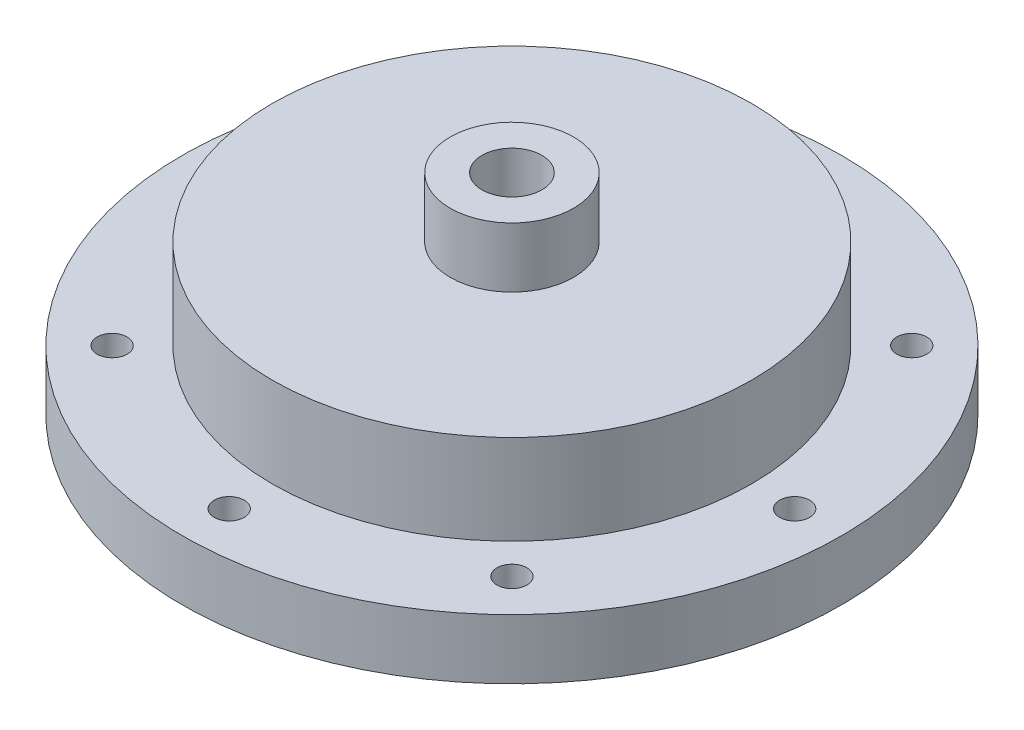
from build123d import *

# Parameters (mm, degrees)
SKETCH1_R           = 50.8
BOSS_EXTRUDE1_DEPTH = 31.75
SKETCH2_R           = 69.85
SKETCH2_R_2         = 50.8
BOSS_EXTRUDE2_DEPTH = 12.7
SKETCH3_R           = 49.53
SKETCH3_R_2         = 47.625
CUT_EXTRUDE1_DEPTH  = 1.1176
CUT_EXTRUDE2_REACH  = 105.76
SKETCH4_R           = 3.175
SKETCH5_R           = 6.35
CUT_EXTRUDE3_DEPTH  = 19.05
CUT_EXTRUDE4_REACH  = 102.603
SKETCH6_R           = 1.5875
CIRPATTERN2_COUNT   = 6
BOSS_EXTRUDE3_START = 12.7
SKETCH34_R          = 13.081
SKETCH34_R_2        = 6.35
BOSS_EXTRUDE3_DEPTH = 12.7


with BuildPart() as part:
    # Sketch1 → Boss-Extrude1 (new body)
    with BuildSketch(Plane(origin=(0, 0, 0), x_dir=(1, 0, 0), z_dir=(0, 1, 0))):
        with Locations(Location((0, 0, 0), (0, 0, 270))):
            Circle(SKETCH1_R)
    extrude(amount=BOSS_EXTRUDE1_DEPTH)

    # Sketch2 → Boss-Extrude2 (add)
    with BuildSketch(Plane.XZ):
        with Locations(Location((0, 0, 0), (0, 0, 270))):
            Circle(SKETCH2_R)
        with Locations(Location((0, 0, 0), (0, 0, 270))):
            Circle(SKETCH2_R_2, mode=Mode.SUBTRACT)
    extrude(amount=-BOSS_EXTRUDE2_DEPTH)

    # Sketch3 → Cut-Extrude1 (cut)
    with BuildSketch(Plane.XZ):
        with Locations(Location((0, 0, 0), (0, 0, 270))):
            Circle(SKETCH3_R)
        with Locations(Location((0, 0, 0), (0, 0, 270))):
            Circle(SKETCH3_R_2, mode=Mode.SUBTRACT)
    extrude(amount=-CUT_EXTRUDE1_DEPTH, mode=Mode.SUBTRACT)

    # Sketch4 → Cut-Extrude2 (cut, up to next)
    with BuildSketch(Plane.XZ, mode=Mode.PRIVATE) as cut_extrude2_sk1:
        with Locations(Location((0, -59.9186, 0), (0, 0, 270))):
            Circle(SKETCH4_R)
    cut_extrude2_tool1 = extrude(cut_extrude2_sk1.sketch, amount=-CUT_EXTRUDE2_REACH, mode=Mode.PRIVATE) & part.part
    # Sketch4 → Cut-Extrude2 (cut, up to next)
    with BuildSketch(Plane.XZ, mode=Mode.PRIVATE) as cut_extrude2_sk2:
        with Locations(Location((-42.368848379, -42.368848379, 0), (0, 0, 270))):
            Circle(SKETCH4_R)
    cut_extrude2_tool2 = extrude(cut_extrude2_sk2.sketch, amount=-CUT_EXTRUDE2_REACH, mode=Mode.PRIVATE) & part.part
    # Sketch4 → Cut-Extrude2 (cut, up to next)
    with BuildSketch(Plane.XZ, mode=Mode.PRIVATE) as cut_extrude2_sk3:
        with Locations(Location((-59.9186, 0, 0), (0, 0, 270))):
            Circle(SKETCH4_R)
    cut_extrude2_tool3 = extrude(cut_extrude2_sk3.sketch, amount=-CUT_EXTRUDE2_REACH, mode=Mode.PRIVATE) & part.part
    # Sketch4 → Cut-Extrude2 (cut, up to next)
    with BuildSketch(Plane.XZ, mode=Mode.PRIVATE) as cut_extrude2_sk4:
        with Locations(Location((-42.368848379, 42.368848379, 0), (0, 0, 270))):
            Circle(SKETCH4_R)
    cut_extrude2_tool4 = extrude(cut_extrude2_sk4.sketch, amount=-CUT_EXTRUDE2_REACH, mode=Mode.PRIVATE) & part.part
    # Sketch4 → Cut-Extrude2 (cut, up to next)
    with BuildSketch(Plane.XZ, mode=Mode.PRIVATE) as cut_extrude2_sk5:
        with Locations(Location((0, 59.9186, 0), (0, 0, 270))):
            Circle(SKETCH4_R)
    cut_extrude2_tool5 = extrude(cut_extrude2_sk5.sketch, amount=-CUT_EXTRUDE2_REACH, mode=Mode.PRIVATE) & part.part
    # Sketch4 → Cut-Extrude2 (cut, up to next)
    with BuildSketch(Plane.XZ, mode=Mode.PRIVATE) as cut_extrude2_sk6:
        with Locations(Location((42.368848379, 42.368848379, 0), (0, 0, 270))):
            Circle(SKETCH4_R)
    cut_extrude2_tool6 = extrude(cut_extrude2_sk6.sketch, amount=-CUT_EXTRUDE2_REACH, mode=Mode.PRIVATE) & part.part
    # Sketch4 → Cut-Extrude2 (cut, up to next)
    with BuildSketch(Plane.XZ, mode=Mode.PRIVATE) as cut_extrude2_sk7:
        with Locations(Location((59.9186, 0, 0), (0, 0, 270))):
            Circle(SKETCH4_R)
    cut_extrude2_tool7 = extrude(cut_extrude2_sk7.sketch, amount=-CUT_EXTRUDE2_REACH, mode=Mode.PRIVATE) & part.part
    # Sketch4 → Cut-Extrude2 (cut, up to next)
    with BuildSketch(Plane.XZ, mode=Mode.PRIVATE) as cut_extrude2_sk8:
        with Locations(Location((42.368848379, -42.368848379, 0), (0, 0, 270))):
            Circle(SKETCH4_R)
    cut_extrude2_tool8 = extrude(cut_extrude2_sk8.sketch, amount=-CUT_EXTRUDE2_REACH, mode=Mode.PRIVATE) & part.part
    add(cut_extrude2_tool1.solids().sort_by_distance((0, 0, -59.9186))[0], mode=Mode.SUBTRACT)
    add(cut_extrude2_tool2.solids().sort_by_distance((-42.368848, 0, -42.368848))[0], mode=Mode.SUBTRACT)
    add(cut_extrude2_tool3.solids().sort_by_distance((-59.9186, 0, 0))[0], mode=Mode.SUBTRACT)
    add(cut_extrude2_tool4.solids().sort_by_distance((-42.368848, 0, 42.368848))[0], mode=Mode.SUBTRACT)
    add(cut_extrude2_tool5.solids().sort_by_distance((0, 0, 59.9186))[0], mode=Mode.SUBTRACT)
    add(cut_extrude2_tool6.solids().sort_by_distance((42.368848, 0, 42.368848))[0], mode=Mode.SUBTRACT)
    add(cut_extrude2_tool7.solids().sort_by_distance((59.9186, 0, 0))[0], mode=Mode.SUBTRACT)
    add(cut_extrude2_tool8.solids().sort_by_distance((42.368848, 0, -42.368848))[0], mode=Mode.SUBTRACT)

    # Sketch5 → Cut-Extrude3 (cut)
    with BuildSketch(Plane(origin=(0, 31.75, 0), x_dir=(1, 0, 0), z_dir=(0, 1, 0))):
        with Locations(Location((0, 0, 0), (0, 0, 270))):
            Circle(SKETCH5_R)
    extrude(amount=-CUT_EXTRUDE3_DEPTH, mode=Mode.SUBTRACT)

    # Sketch6 → Cut-Extrude4 (cut, up to next)
    with BuildSketch(Plane(origin=(0, 12.7, 0), x_dir=(1, 0, 0), z_dir=(0, 1, 0)), mode=Mode.PRIVATE) as cut_extrude4_sk1:
        with Locations(Location((0, 0, 0), (0, 0, 270))):
            Circle(SKETCH6_R)
    cut_extrude4_tool1 = extrude(cut_extrude4_sk1.sketch, amount=-CUT_EXTRUDE4_REACH, mode=Mode.PRIVATE) & part.part
    add(cut_extrude4_tool1.solids().sort_by_distance((0, 12.7, 0))[0], mode=Mode.SUBTRACT)

    # Cut-Sweep8: read off the stored shape, not the designer's step
    # Cut-Sweep8: loft between two sections, ruled curve by curve
    cut_sweep8_from = [
        Edge.make_bspline([(0, 13.990935229, -6.31114181), (2.38125, 13.990935229, -6.31114181), (2.38125, 13.700001029, -3.947731381), (0, 13.700001029, -3.947731381), (-2.38125, 13.700001029, -3.947731381), (-2.38125, 13.990935229, -6.31114181), (0, 13.990935229, -6.31114181)], [0, 0, 0, 0, 0.5, 0.5, 0.5, 1, 1, 1, 1], 3, [1, 0.333333333, 0.333333333, 1, 0.333333333, 0.333333333, 1]),
    ]
    cut_sweep8_to = [
        Edge.make_bspline([(0, -48.271883257, 1.309904341), (2.38125, -48.271883257, 1.309904341), (2.38125, -48.562817457, 3.67331477), (0, -48.562817457, 3.67331477), (-2.38125, -48.562817457, 3.67331477), (-2.38125, -48.271883257, 1.309904341), (0, -48.271883257, 1.309904341)], [0, 0, 0, 0, 0.5, 0.5, 0.5, 1, 1, 1, 1], 3, [1, 0.333333333, 0.333333333, 1, 0.333333333, 0.333333333, 1]),
    ]
    cut_sweep8 = Solid(Shell([*[Face.make_surface_from_curves(cut_sweep8_from[k], cut_sweep8_to[k]) for k in range(1)], Face(Wire(cut_sweep8_from)), Face(Wire(cut_sweep8_to))]))
    add(cut_sweep8, mode=Mode.SUBTRACT)

    # Cut-Sweep8 2: loft between two sections, ruled curve by curve
    cut_sweep8_2_from = [
        Edge.make_bspline([(0, -48.575136164, 6.303833973), (2.38125, -48.575136164, 6.303833973), (2.38125, -48.575136164, 3.922583973), (0, -48.575136164, 3.922583973), (-2.38125, -48.575136164, 3.922583973), (-2.38125, -48.575136164, 6.303833973), (0, -48.575136164, 6.303833973)], [0, 0, 0, 0, 0.5, 0.5, 0.5, 1, 1, 1, 1], 3, [1, 0.333333333, 0.333333333, 1, 0.333333333, 0.333333333, 1]),
    ]
    cut_sweep8_2_to = [
        Edge.make_bspline([(0, 12.7, -8.969375), (2.38125, 12.7, -8.969375), (2.38125, 12.7, -11.350625), (0, 12.7, -11.350625), (-2.38125, 12.7, -11.350625), (-2.38125, 12.7, -8.969375), (0, 12.7, -8.969375)], [0, 0, 0, 0, 0.5, 0.5, 0.5, 1, 1, 1, 1], 3, [1, 0.333333333, 0.333333333, 1, 0.333333333, 0.333333333, 1]),
    ]
    cut_sweep8_2 = Solid(Shell([*[Face.make_surface_from_curves(cut_sweep8_2_from[k], cut_sweep8_2_to[k]) for k in range(1)], Face(Wire(cut_sweep8_2_from)), Face(Wire(cut_sweep8_2_to))]))
    add(cut_sweep8_2, mode=Mode.SUBTRACT)

    # CirPattern2: Cut-Sweep8, Cut-Sweep8 2 ×6 about axis
    cirpattern2_axis = Axis((0, -28.061269261, 0), (0, 1, 0))
    add([cut_sweep8.rotate(cirpattern2_axis, i * 360 / CIRPATTERN2_COUNT) for i in range(1, CIRPATTERN2_COUNT)], mode=Mode.SUBTRACT)
    add([cut_sweep8_2.rotate(cirpattern2_axis, i * 360 / CIRPATTERN2_COUNT) for i in range(1, CIRPATTERN2_COUNT)], mode=Mode.SUBTRACT)

    # Sketch34 → Boss-Extrude3 (add)
    with BuildSketch(Plane(origin=(0, 31.75, 0), x_dir=(1, 0, 0), z_dir=(0, 1, 0)).offset(BOSS_EXTRUDE3_START)):
        with Locations(Location((0, 0, 0), (0, 0, 270))):
            Circle(SKETCH34_R)
        with Locations(Location((0, 0, 0), (0, 0, 270))):
            Circle(SKETCH34_R_2, mode=Mode.SUBTRACT)
    extrude(amount=-BOSS_EXTRUDE3_DEPTH)


solid = part.part
